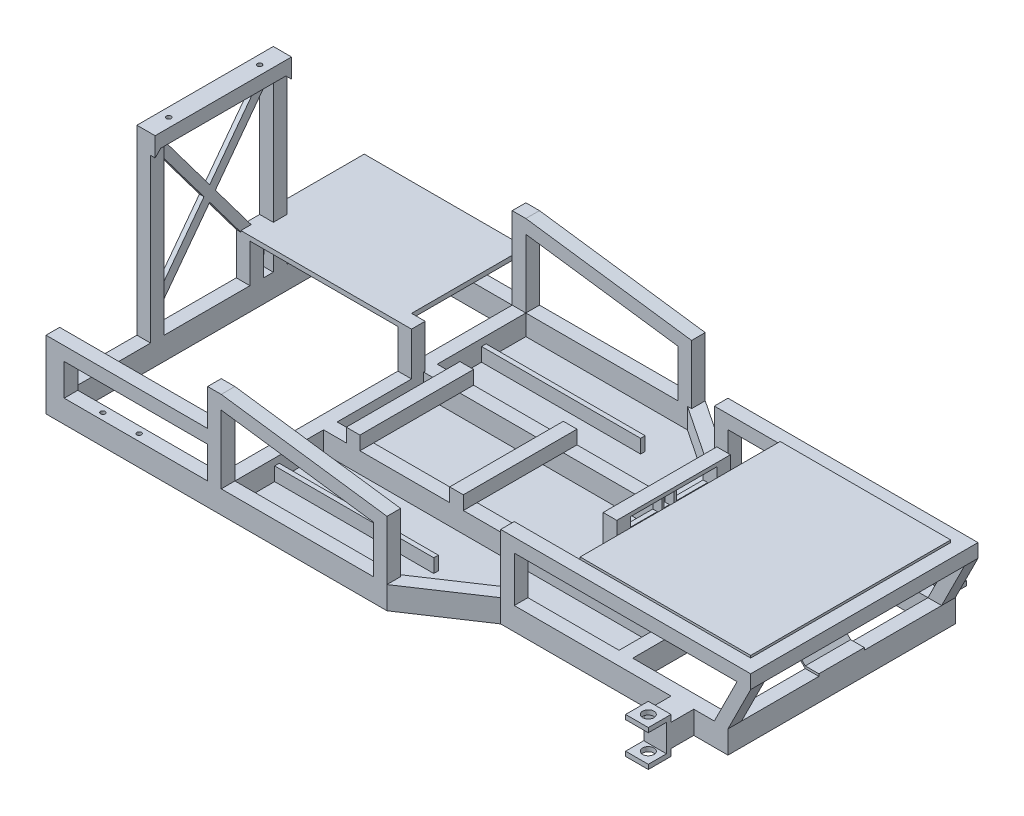
from build123d import *

# Parameters (mm, degrees)
SKETCH1_W            = 32.545837
SKETCH1_H            = 64
SKETCH1_W_2          = 20.954163
SKETCH1_H_2          = 44
SKETCH1_W_3          = 74.5
SKETCH1_H_3          = 19
BOSS_EXTRUDE1_DEPTH  = 2.5
BOSS_EXTRUDE3_DEPTH  = 0.5
SKETCH3_W            = 5
SKETCH3_H            = 5
BOSS_EXTRUDE4_DEPTH  = 5
SKETCH6_W            = 5
SKETCH6_H            = 8
BOSS_EXTRUDE5_DEPTH  = 1
SKETCH7_W            = 5
SKETCH7_H            = 5
BOSS_EXTRUDE7_DEPTH  = 8
SKETCH8_W            = 5
SKETCH8_H            = 6
CUT_EXTRUDE1_DEPTH   = 4
SKETCH9_R            = 1.25
CUT_EXTRUDE2_DEPTH   = 84.150466
SKETCH10_W           = 5
SKETCH10_H           = 5
BOSS_EXTRUDE10_DEPTH = 5
SKETCH12_W           = 5
SKETCH12_H           = 8
BOSS_EXTRUDE11_DEPTH = 5
SKETCH13_W           = 5
SKETCH13_H           = 6
CUT_EXTRUDE3_DEPTH   = 4
SKETCH14_R           = 1.25
CUT_EXTRUDE4_DEPTH   = 84.150466
BOSS_EXTRUDE12_DEPTH = 4
SKETCH19_W           = 3
SKETCH19_H           = 3
BOSS_EXTRUDE13_DEPTH = 18
SKETCH21_W           = 3
SKETCH21_H           = 3
BOSS_EXTRUDE14_DEPTH = 10
SKETCH22_W           = 55
SKETCH22_H           = 3
BOSS_EXTRUDE15_DEPTH = 3
BOSS_EXTRUDE17_DEPTH = 3
BOSS_EXTRUDE18_DEPTH = 3
SKETCH25_W           = 44
SKETCH25_H           = 3
BOSS_EXTRUDE19_DEPTH = 3
CUT_EXTRUDE5_REACH   = 100.234
SKETCH31_R           = 0.5
BOSS_EXTRUDE24_DEPTH = 3
BOSS_EXTRUDE25_DEPTH = 3
SKETCH38_R           = 0.5
CUT_EXTRUDE6_DEPTH   = 3
SKETCH40_W           = 28.142695
SKETCH40_H           = 1
BOSS_EXTRUDE26_DEPTH = 35.545837
SKETCH43_W           = 3
SKETCH43_H           = 9.5
BOSS_EXTRUDE31_DEPTH = 3
SKETCH44_W           = 3
SKETCH44_H           = 9.5
BOSS_EXTRUDE32_DEPTH = 3
SKETCH46_W           = 35
SKETCH46_H           = 1
BOSS_EXTRUDE33_DEPTH = 3
BOSS_EXTRUDE34_DEPTH = 0.5
BOSS_EXTRUDE35_DEPTH = 10
SKETCH49_W           = 3
SKETCH49_H           = 3
BOSS_EXTRUDE36_DEPTH = 15
SKETCH51_W           = 3
SKETCH51_H           = 40
SKETCH51_H_2         = 45
BOSS_EXTRUDE37_DEPTH = 3
CUT_EXTRUDE8_DEPTH   = 4
SKETCH53_W           = 38.545837
SKETCH53_H           = 3
BOSS_EXTRUDE38_DEPTH = 3
SKETCH54_W           = 3
SKETCH54_H           = 25
BOSS_EXTRUDE39_DEPTH = 0.8
SKETCH55_W           = 22
SKETCH55_H           = 2
BOSS_EXTRUDE40_DEPTH = 1
SKETCH56_W           = 0.5
SKETCH56_H           = 4.8
BOSS_EXTRUDE41_DEPTH = 1
SKETCH57_W           = 19
SKETCH57_H           = 4
CUT_EXTRUDE9_DEPTH   = 5
SKETCH58_W           = 0.5
SKETCH58_H           = 4.8
BOSS_EXTRUDE42_DEPTH = 2
SKETCH59_W           = 3
SKETCH59_H           = 25
BOSS_EXTRUDE43_DEPTH = 3
SKETCH60_W           = 35
SKETCH60_H           = 1
BOSS_EXTRUDE44_DEPTH = 3
BOSS_EXTRUDE45_DEPTH = 1
CUT_EXTRUDE10_DEPTH  = 1
SKETCH64_W           = 37.510477
SKETCH64_H           = 44
BOSS_EXTRUDE49_DEPTH = 0.5


with BuildPart() as part:
    # Sketch1 → Boss-Extrude1 (new, symmetric)
    with BuildSketch(Plane(origin=(0, 0, 0), x_dir=(1, 0, 0), z_dir=(0, 1, 0))):
        Polygon((-65, 35), (10, 35), (25, 25), (75, 25), (75, -25), (25, -25), (10, -35), (-65, -35), align=None)
        with Locations((-45.727081, 0)):
            Rectangle(SKETCH1_W, SKETCH1_H, mode=Mode.SUBTRACT)
        Polygon((24.091673, -22), (9.091673, -32), (-26.454163, -32), (-26.454163, -12.5), (48.045837, -12.5), (48.045837, -22), align=None, mode=Mode.SUBTRACT)
        with Locations((61.522919, 0)):
            Rectangle(SKETCH1_W_2, SKETCH1_H_2, mode=Mode.SUBTRACT)
        Polygon((24.091673, 22), (48.045837, 22), (48.045837, 12.5), (-26.454163, 12.5), (-26.454163, 32), (9.091673, 32), align=None, mode=Mode.SUBTRACT)
        with Locations((10.795837, 0)):
            Rectangle(SKETCH1_W_3, SKETCH1_H_3, mode=Mode.SUBTRACT)
    extrude(amount=BOSS_EXTRUDE1_DEPTH, both=True)

    # Sketch2 → Boss-Extrude3 (add)
    with BuildSketch(Plane.XZ.offset(2.5)):
        Polygon((9.091673, 32), (24.091673, 22), (48.045837, 22), (48.045837, -22), (24.091673, -22), (9.091673, -32), (-26.454163, -32), (-26.454163, 32), align=None)
    extrude(amount=-BOSS_EXTRUDE3_DEPTH)

    # Sketch3 → Boss-Extrude4 (add)
    with BuildSketch(Plane.XY.offset(25)):
        with Locations((64.979753, 0)):
            Rectangle(SKETCH3_W, SKETCH3_H)
    extrude(amount=BOSS_EXTRUDE4_DEPTH)

    # Sketch6 → Boss-Extrude5 (add)
    with BuildSketch(Plane.XY.offset(30)):
        with Locations((64.979753, 0)):
            Rectangle(SKETCH6_W, SKETCH6_H)
    extrude(amount=BOSS_EXTRUDE5_DEPTH)

    # Sketch7 → Boss-Extrude7 (add)
    with BuildSketch(Plane(origin=(0, 4, 0), x_dir=(1, 0, 0), z_dir=(0, 1, 0))):
        with Locations((64.979753, -32.5)):
            Rectangle(SKETCH7_W, SKETCH7_H)
    extrude(amount=-BOSS_EXTRUDE7_DEPTH)

    # Sketch8 → Cut-Extrude1 (cut)
    with BuildSketch(Plane.XY.offset(35)):
        with Locations((64.979753, 0)):
            Rectangle(SKETCH8_W, SKETCH8_H)
    extrude(amount=-CUT_EXTRUDE1_DEPTH, mode=Mode.SUBTRACT)

    # Sketch9 → Cut-Extrude2 (cut, through all)
    with BuildSketch(Plane(origin=(0, 4, 0), x_dir=(1, 0, 0), z_dir=(0, 1, 0))):
        with Locations(Location((64.979753, -32.5, 0), (0, 0, 270))):
            Circle(SKETCH9_R)
    extrude(amount=-CUT_EXTRUDE2_DEPTH, mode=Mode.SUBTRACT)

    # Sketch10 → Boss-Extrude10 (add)
    with BuildSketch(Plane(origin=(0, 0, -25), x_dir=(-1, 0, 0), z_dir=(0, 0, -1))):
        with Locations((-64.979753, 0)):
            Rectangle(SKETCH10_W, SKETCH10_H)
    extrude(amount=BOSS_EXTRUDE10_DEPTH)

    # Sketch12 → Boss-Extrude11 (add)
    with BuildSketch(Plane(origin=(0, 0, -30), x_dir=(-1, 0, 0), z_dir=(0, 0, -1))):
        with Locations((-64.979753, 0)):
            Rectangle(SKETCH12_W, SKETCH12_H)
    extrude(amount=BOSS_EXTRUDE11_DEPTH)

    # Sketch13 → Cut-Extrude3 (cut)
    with BuildSketch(Plane(origin=(0, 0, -35), x_dir=(-1, 0, 0), z_dir=(0, 0, -1))):
        with Locations((-64.979753, 0)):
            Rectangle(SKETCH13_W, SKETCH13_H)
    extrude(amount=-CUT_EXTRUDE3_DEPTH, mode=Mode.SUBTRACT)

    # Sketch14 → Cut-Extrude4 (cut, through all)
    with BuildSketch(Plane(origin=(0, 4, 0), x_dir=(1, 0, 0), z_dir=(0, 1, 0))):
        with Locations(Location((64.979753, 32.5, 0), (0, 0, 270))):
            Circle(SKETCH14_R)
    extrude(amount=-CUT_EXTRUDE4_DEPTH, mode=Mode.SUBTRACT)

    # Sketch16 → Boss-Extrude12 (add)
    with BuildSketch(Plane.ZY.offset(65)):
        Polygon((35, 2.5), (35, 22.5), (15, 42.5), (-15, 42.5), (-35, 22.5), (-35, 2.5), (-32, 2.5), (-32, 5.5), (-32, 21.257359), (-13.757359, 39.5), (13.757359, 39.5), (32, 21.257359), (32, 5.5), (32, 2.5), align=None)
    extrude(amount=-BOSS_EXTRUDE12_DEPTH)

    # Sketch19 → Boss-Extrude13 (add)
    with BuildSketch(Plane(origin=(0, 2.5, 0), x_dir=(1, 0, 0), z_dir=(0, 1, 0))):
        with Locations((-27.954163, 33.5)):
            Rectangle(SKETCH19_W, SKETCH19_H)
        with Locations((-27.954163, -33.5)):
            Rectangle(SKETCH19_W, SKETCH19_H)
    extrude(amount=BOSS_EXTRUDE13_DEPTH)

    # Sketch21 → Boss-Extrude14 (add)
    with BuildSketch(Plane(origin=(0, 2.5, 0), x_dir=(1, 0, 0), z_dir=(0, 1, 0))):
        with Locations((26.5, -23.5)):
            Rectangle(SKETCH21_W, SKETCH21_H)
        with Locations((26.5, 23.5)):
            Rectangle(SKETCH21_W, SKETCH21_H)
    extrude(amount=BOSS_EXTRUDE14_DEPTH)

    # Sketch22 → Boss-Extrude15 (add)
    with BuildSketch(Plane(origin=(0, 12.5, 0), x_dir=(1, 0, 0), z_dir=(0, 1, 0))):
        with Locations((52.5, 23.5)):
            Rectangle(SKETCH22_W, SKETCH22_H)
        with Locations((52.5, -23.5)):
            Rectangle(SKETCH22_W, SKETCH22_H)
    extrude(amount=BOSS_EXTRUDE15_DEPTH)

    # Sketch23 → Boss-Extrude17 (add)
    with BuildSketch(Plane.XY.offset(25)):
        Polygon((80, 12.5), (75, 2.5), (72, 2.5), (77, 12.5), align=None)
    extrude(amount=-BOSS_EXTRUDE17_DEPTH)

    # Sketch24 → Boss-Extrude18 (add)
    with BuildSketch(Plane(origin=(0, 0, -25), x_dir=(-1, 0, 0), z_dir=(0, 0, -1))):
        Polygon((-75, 2.5), (-80, 12.5), (-77, 12.5), (-72, 2.5), align=None)
    extrude(amount=-BOSS_EXTRUDE18_DEPTH)

    # Sketch25 → Boss-Extrude19 (add)
    with BuildSketch(Plane(origin=(80, 0, 0), x_dir=(0, 0, -1), z_dir=(1, 0, 0))):
        with Locations((0, 14)):
            Rectangle(SKETCH25_W, SKETCH25_H)
    extrude(amount=-BOSS_EXTRUDE19_DEPTH)

    # Sketch31 → Cut-Extrude5 (cut, up to next)
    with BuildSketch(Plane.XZ.offset(2.5), mode=Mode.PRIVATE) as cut_extrude5_sk1:
        with Locations(Location((-46, 33.5, 0), (0, 0, 270))):
            Circle(SKETCH31_R)
    cut_extrude5_tool1 = extrude(cut_extrude5_sk1.sketch, amount=-CUT_EXTRUDE5_REACH, mode=Mode.PRIVATE) & part.part
    # Sketch31 → Cut-Extrude5 (cut, up to next)
    with BuildSketch(Plane.XZ.offset(2.5), mode=Mode.PRIVATE) as cut_extrude5_sk2:
        with Locations(Location((-54, 33.5, 0), (0, 0, 270))):
            Circle(SKETCH31_R)
    cut_extrude5_tool2 = extrude(cut_extrude5_sk2.sketch, amount=-CUT_EXTRUDE5_REACH, mode=Mode.PRIVATE) & part.part
    # Sketch31 → Cut-Extrude5 (cut, up to next)
    with BuildSketch(Plane.XZ.offset(2.5), mode=Mode.PRIVATE) as cut_extrude5_sk3:
        with Locations(Location((-54, -33.5, 0), (0, 0, 270))):
            Circle(SKETCH31_R)
    cut_extrude5_tool3 = extrude(cut_extrude5_sk3.sketch, amount=-CUT_EXTRUDE5_REACH, mode=Mode.PRIVATE) & part.part
    # Sketch31 → Cut-Extrude5 (cut, up to next)
    with BuildSketch(Plane.XZ.offset(2.5), mode=Mode.PRIVATE) as cut_extrude5_sk4:
        with Locations(Location((-46, -33.5, 0), (0, 0, 270))):
            Circle(SKETCH31_R)
    cut_extrude5_tool4 = extrude(cut_extrude5_sk4.sketch, amount=-CUT_EXTRUDE5_REACH, mode=Mode.PRIVATE) & part.part
    add(cut_extrude5_tool1.solids().sort_by_distance((-46, -2.5, 33.5))[0], mode=Mode.SUBTRACT)
    add(cut_extrude5_tool2.solids().sort_by_distance((-54, -2.5, 33.5))[0], mode=Mode.SUBTRACT)
    add(cut_extrude5_tool3.solids().sort_by_distance((-54, -2.5, -33.5))[0], mode=Mode.SUBTRACT)
    add(cut_extrude5_tool4.solids().sort_by_distance((-46, -2.5, -33.5))[0], mode=Mode.SUBTRACT)

    # Sketch36 → Boss-Extrude25 (add)
    with BuildSketch(Plane(origin=(0, 0, -35), x_dir=(-1, 0, 0), z_dir=(0, 0, -1))):
        Polygon((-10, 2.5), (-10, 15.5), (26.454163, 20.5), (26.454163, 17.5), (-7, 12.911476), (-7, 2.5), align=None)
    extrude(amount=-BOSS_EXTRUDE25_DEPTH)

    # Sketch38 → Cut-Extrude6 (cut)
    with BuildSketch(Plane(origin=(0, 42.5, 0), x_dir=(1, 0, 0), z_dir=(0, 1, 0))):
        with Locations(Location((-63, 10, 0), (0, 0, 270))):
            Circle(SKETCH38_R)
        with Locations(Location((-63, -10, 0), (0, 0, 270))):
            Circle(SKETCH38_R)
    extrude(amount=-CUT_EXTRUDE6_DEPTH, mode=Mode.SUBTRACT)

    # Sketch40 → Boss-Extrude26 (add, through all)
    with BuildSketch(Plane.ZY.offset(29.454163)):
        with Locations((-20.928652, 11.5)):
            Rectangle(SKETCH40_W, SKETCH40_H)
    extrude(amount=BOSS_EXTRUDE26_DEPTH)

    # Sketch43 → Boss-Extrude31 (add)
    with BuildSketch(Plane.ZY.offset(65)):
        with Locations((-8.357305, 7.25)):
            Rectangle(SKETCH43_W, SKETCH43_H)
    extrude(amount=-BOSS_EXTRUDE31_DEPTH)

    # Sketch44 → Boss-Extrude32 (add)
    with BuildSketch(Plane(origin=(-29.454163, 0, 0), x_dir=(0, 0, -1), z_dir=(1, 0, 0))):
        with Locations((8.357305, 7.25)):
            Rectangle(SKETCH44_W, SKETCH44_H)
    extrude(amount=BOSS_EXTRUDE32_DEPTH)

    # Sketch46 → Boss-Extrude33 (add)
    with BuildSketch(Plane(origin=(0, -2, 0), x_dir=(1, 0, 0), z_dir=(0, 1, 0))):
        with Locations((-8.954163, 22.75)):
            Rectangle(SKETCH46_W, SKETCH46_H)
    extrude(amount=BOSS_EXTRUDE33_DEPTH)

    # Sketch47 → Boss-Extrude34 (add)
    with BuildSketch(Plane(origin=(0, 2.5, 0), x_dir=(1, 0, 0), z_dir=(0, 1, 0))):
        Polygon((75, 0), (75, 5), (72, 5), (72, -5), (75, -5), align=None)
    extrude(amount=BOSS_EXTRUDE34_DEPTH)

    # Sketch48 → Boss-Extrude35 (add)
    with BuildSketch(Plane.XY.offset(5)):
        Polygon((69.87868, 4.62132), (72, 2.5), (72, 3), (69.87868, 5.12132), align=None)
    extrude(amount=-BOSS_EXTRUDE35_DEPTH)

    # Sketch49 → Boss-Extrude36 (add)
    with BuildSketch(Plane(origin=(0, 2.5, 0), x_dir=(1, 0, 0), z_dir=(0, 1, 0))):
        with Locations((36.545837, -11)):
            Rectangle(SKETCH49_W, SKETCH49_H)
        with Locations((36.545837, 11)):
            Rectangle(SKETCH49_W, SKETCH49_H)
    extrude(amount=BOSS_EXTRUDE36_DEPTH)

    # Sketch51 → Boss-Extrude37 (add)
    with BuildSketch(Plane.ZY.offset(65)):
        with Locations((-13.5, 22.5)):
            Rectangle(SKETCH51_W, SKETCH51_H)
        with Locations((13.5, 20)):
            Rectangle(SKETCH51_W, SKETCH51_H_2)
    extrude(amount=-BOSS_EXTRUDE37_DEPTH)

    # Sketch52 → Cut-Extrude8 (cut)
    with BuildSketch(Plane.ZY.offset(65)):
        Polygon((-32, 12), (-35, 12), (-35, 22.5), (-15, 42.5), (-15, 12), align=None)
        Polygon((15, 12.5), (35, 12.5), (35, 22.5), (15, 42.5), align=None)
    extrude(amount=-CUT_EXTRUDE8_DEPTH, mode=Mode.SUBTRACT)


with BuildPart() as body_2:
    # Sketch35 → Boss-Extrude24 (new body)
    with BuildSketch(Plane.XY.offset(35)):
        Polygon((10, 2.5), (10, 12.5), (10, 15.5), (-26.454163, 20.5), (-26.454163, 17.5), (7, 12.911476), (7, 2.5), align=None)
    extrude(amount=-BOSS_EXTRUDE24_DEPTH)


    add(part.part)  # Boss-Extrude38 merges part
    # Sketch53 → Boss-Extrude38 (add)
    with BuildSketch(Plane.XY.offset(35)):
        with Locations((-45.727081, 11)):
            Rectangle(SKETCH53_W, SKETCH53_H)
    extrude(amount=-BOSS_EXTRUDE38_DEPTH)

    # Sketch54 → Boss-Extrude39 (add)
    with BuildSketch(Plane(origin=(0, 17.5, 0), x_dir=(1, 0, 0), z_dir=(0, 1, 0))):
        with Locations((36.545837, 0)):
            Rectangle(SKETCH54_W, SKETCH54_H)
    extrude(amount=-BOSS_EXTRUDE39_DEPTH)

    # Sketch55 → Boss-Extrude40 (add)
    with BuildSketch(Plane.ZY.offset(-35.045837)):
        with Locations((-1.5, 11.7)):
            Rectangle(SKETCH55_W, SKETCH55_H)
    extrude(amount=-BOSS_EXTRUDE40_DEPTH)

    # Sketch56 → Boss-Extrude41 (add)
    with BuildSketch(Plane.ZY.offset(-35.045837)):
        with Locations((2.381842, 15.1)):
            Rectangle(SKETCH56_W, SKETCH56_H)
        with Locations((-0.400342, 15.1)):
            Rectangle(SKETCH56_W, SKETCH56_H)
    extrude(amount=-BOSS_EXTRUDE41_DEPTH)

    # Sketch57 → Cut-Extrude9 (cut, symmetric)
    with BuildSketch(Plane.ZY.offset(-35.045837)):
        with Locations((0, 14.7)):
            Rectangle(SKETCH57_W, SKETCH57_H)
    extrude(amount=CUT_EXTRUDE9_DEPTH, both=True, mode=Mode.SUBTRACT)

    # Sketch58 → Boss-Extrude42 (add)
    with BuildSketch(Plane.ZY.offset(-35.045837)):
        with Locations((1.324841, 15.1)):
            Rectangle(SKETCH58_W, SKETCH58_H)
        with Locations((-1.337285, 15.1)):
            Rectangle(SKETCH58_W, SKETCH58_H)
    extrude(amount=-BOSS_EXTRUDE42_DEPTH)

    # Sketch59 → Boss-Extrude43 (add)
    with BuildSketch(Plane(origin=(0, 2.5, 0), x_dir=(1, 0, 0), z_dir=(0, 1, 0))):
        with Locations((-19.954163, 0)):
            Rectangle(SKETCH59_W, SKETCH59_H)
        with Locations((2.795837, 0)):
            Rectangle(SKETCH59_W, SKETCH59_H)
    extrude(amount=BOSS_EXTRUDE43_DEPTH)

    # Sketch60 → Boss-Extrude44 (add)
    with BuildSketch(Plane(origin=(0, -2, 0), x_dir=(1, 0, 0), z_dir=(0, 1, 0))):
        with Locations((-8.954163, -22.75)):
            Rectangle(SKETCH60_W, SKETCH60_H)
    extrude(amount=BOSS_EXTRUDE44_DEPTH)

    # Sketch61 → Boss-Extrude45 (add)
    with BuildSketch(Plane.ZY.offset(65)):
        Polygon((-1.25, 22.5), (-15, 4.166667), (-13.4, 2.966667), (0, 20.833333), (13.4, 2.966667), (15, 4.166667), (1.25, 22.5), (15.35, 41.3), (13.75, 42.5), (0, 24.166667), (-13.4, 42.033333), (-15, 40.833333), align=None)
    extrude(amount=-BOSS_EXTRUDE45_DEPTH)

    # Sketch62 → Cut-Extrude10 (cut)
    with BuildSketch(Plane.ZY.offset(65)):
        Polygon((15, 41.5625), (15, 40.833333), (15.35, 41.3), align=None)
    extrude(amount=-CUT_EXTRUDE10_DEPTH, mode=Mode.SUBTRACT)


with BuildPart() as body_2_2:
    # Sketch64 → Boss-Extrude49 (new body)
    with BuildSketch(Plane(origin=(0, 15.5, 0), x_dir=(1, 0, 0), z_dir=(0, 1, 0))):
        with Locations((58.244761, 0)):
            Rectangle(SKETCH64_W, SKETCH64_H)
    extrude(amount=BOSS_EXTRUDE49_DEPTH)


solid = Compound([body_2.part, body_2_2.part])
